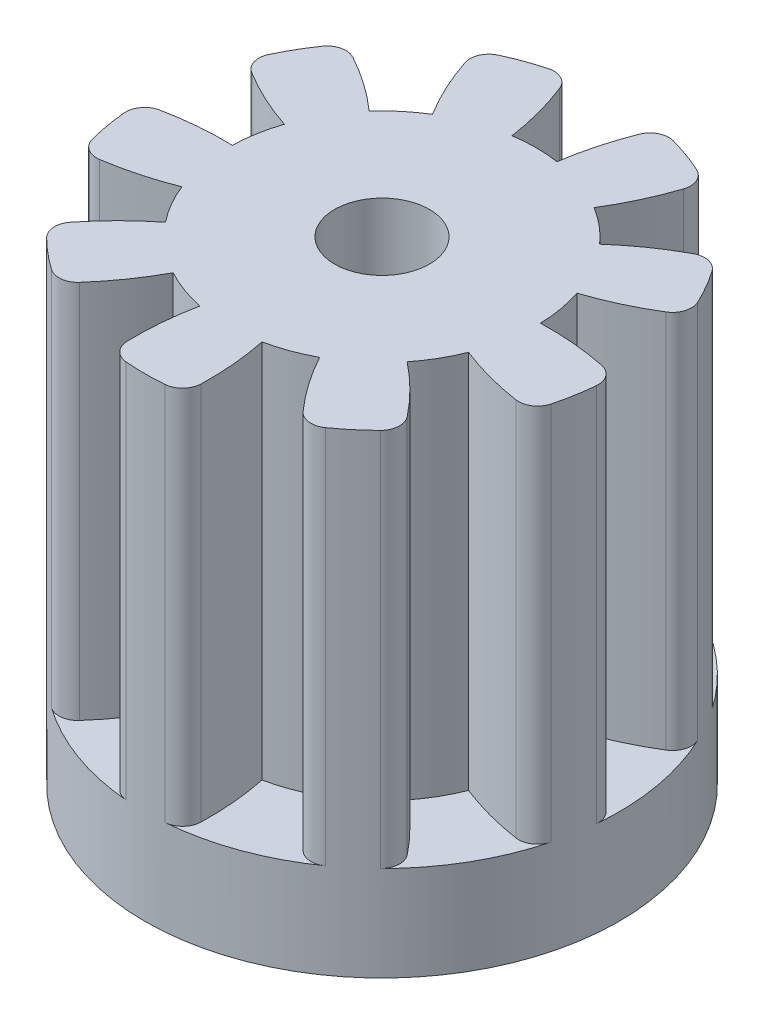
from build123d import *
from build123d.topology import SkipClean

# Parameters (mm, degrees)
SKETCH1_R           = 1.25
SKETCH1_R_2         = 0.25
BOSS_EXTRUDE1_DEPTH = 2.5
CUT_EXTRUDE1_DEPTH  = 4.061862178
CIRPATTERN1_COUNT   = 9
FILLET1_R           = 0.1
SKETCH3_R           = 1.25
BOSS_EXTRUDE2_DEPTH = 0.5


with BuildPart() as part:
    # Sketch1 → Boss-Extrude1 (new body)
    with BuildSketch(Plane(origin=(0, 0, 0), x_dir=(1, 0, 0), z_dir=(0, 1, 0))):
        Circle(SKETCH1_R)
        Circle(SKETCH1_R_2, mode=Mode.SUBTRACT)
    extrude(amount=BOSS_EXTRUDE1_DEPTH)

    # Sketch2 → Cut-Extrude1 (cut, through all)
    with BuildSketch(Plane(origin=(0, 2.5, 0), x_dir=(1, 0, 0), z_dir=(0, 1, 0))):
        with BuildLine():
            ThreePointArc((-0.243920771, 1.225970088), (-0.166115152, 1.019374159), (-0.118455333, 0.803818751))
            ThreePointArc((-0.118455333, 0.803818751), (0, 0.8125), (0.118455333, 0.803818751))
            ThreePointArc((0.118455333, 0.803818751), (0.166115152, 1.019374159), (0.243920771, 1.225970088))
            ThreePointArc((0.243920771, 1.225970088), (0, 1.25), (-0.243920771, 1.225970088))
        make_face()
    cut_extrude1 = extrude(amount=-CUT_EXTRUDE1_DEPTH, mode=Mode.SUBTRACT)

    # CirPattern1: Cut-Extrude1 ×9 about axis
    cirpattern1_axis = Axis((0, 2.5, 0), (0, -1, 0))
    for i in range(1, CIRPATTERN1_COUNT):
        add(cut_extrude1.rotate(cirpattern1_axis, i * 360 / CIRPATTERN1_COUNT), mode=Mode.SUBTRACT)

    # Fillet1
    fillet1_edges = [part.edges().sort_by_distance(p)[0] for p in [
        (0.974892534, 1.25, -0.782358324),
        (0.243920771, 1.25, -1.225970088),
        (0.601184231, 1.25, -1.095936823),
        (1.164988451, 1.25, -0.453102538),
        (1.249701245, 1.25, 0.027327595),
        (0.939760855, 1.25, 0.824226628),
        (1.183681626, 1.25, 0.40174346),
        (0.190095917, 1.25, 1.235460862),
        (0.648517014, 1.25, 1.068609228),
        (-0.190095917, 1.25, 1.235460862),
        (-0.648517014, 1.25, 1.068609228),
        (-0.939760855, 1.25, 0.824226628),
        (-1.183681626, 1.25, 0.40174346),
        (-1.249701245, 1.25, 0.027327595),
        (-1.164988451, 1.25, -0.453102538),
        (-0.974892534, 1.25, -0.782358324),
        (-0.243920771, 1.25, -1.225970088),
        (-0.601184231, 1.25, -1.095936823),
    ]]
    fillet(fillet1_edges, radius=FILLET1_R)

    # Sketch3 → Boss-Extrude2 (add)
    with SkipClean():  # the faces are left unmerged after this step: merging them gives an invalid solid
        with BuildSketch(Plane(origin=(0, 0, 0), x_dir=(1, 0, 0), z_dir=(0, 1, 0))):
            Circle(SKETCH3_R)
        extrude(amount=BOSS_EXTRUDE2_DEPTH)
    add(part.part.scale(1), mode=Mode.REPLACE)  # the faces are merged on a copy


solid = part.part
